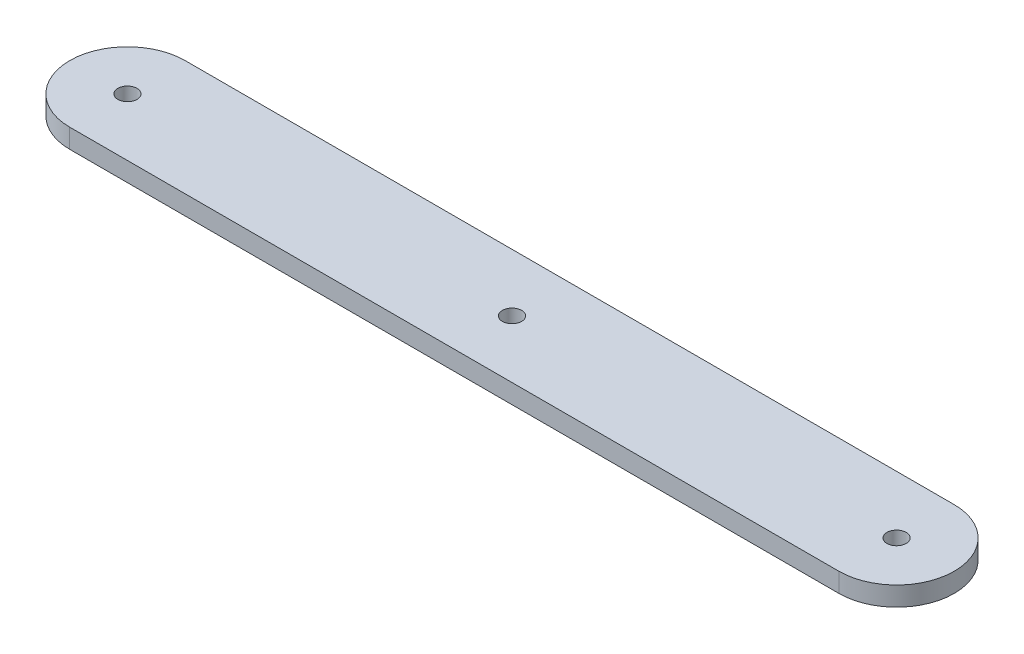
from build123d import *

# Parameters (mm, degrees)
SKETCH_1_R      = 2.5
EXTRUDE_1_DEPTH = 5


with BuildPart() as part:
    # 草图1 → 凸台-拉伸1 (new body)
    with BuildSketch(Plane(origin=(0, 0, 0), x_dir=(1, 0, 0), z_dir=(0, 1, 0))):
        with BuildLine():
            Line((0, 15), (200, 15))
            ThreePointArc((200, 15), (215, 0), (200, -15))
            Line((200, -15), (0, -15))
            ThreePointArc((0, -15), (-15, 0), (0, 15))
        make_face()
        with Locations((200, 0)):
            Circle(SKETCH_1_R, mode=Mode.SUBTRACT)
        with Locations((100, 0)):
            Circle(SKETCH_1_R, mode=Mode.SUBTRACT)
        Circle(SKETCH_1_R, mode=Mode.SUBTRACT)
    extrude(amount=EXTRUDE_1_DEPTH)


solid = part.part
